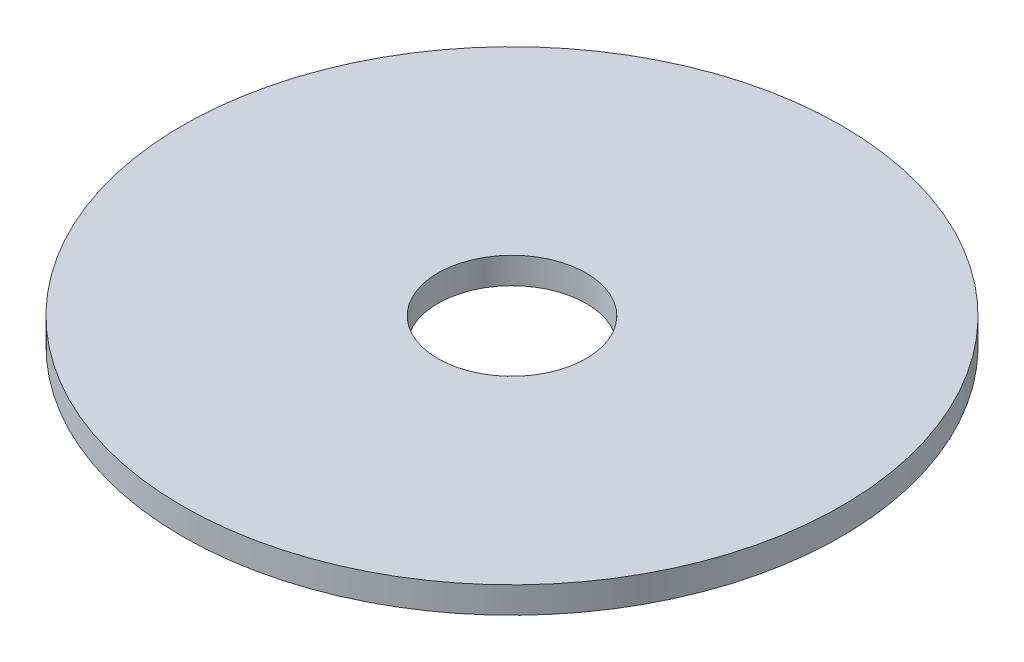
from build123d import *

# Parameters (mm, degrees)
SKETCH1_R           = 100
BOSS_EXTRUDE1_DEPTH = 8
SKETCH2_R           = 22.5
CUT_EXTRUDE1_DEPTH  = 142.647449677


with BuildPart() as part:
    # Sketch1 → Boss-Extrude1 (new body)
    with BuildSketch(Plane(origin=(0, 0, 0), x_dir=(1, 0, 0), z_dir=(0, 1, 0))):
        Circle(SKETCH1_R)
    extrude(amount=BOSS_EXTRUDE1_DEPTH)

    # Sketch2 → Cut-Extrude1 (cut, through all)
    with BuildSketch(Plane(origin=(0, 0, 0), x_dir=(1, 0, 0), z_dir=(0, 1, 0))):
        Circle(SKETCH2_R)
    extrude(amount=CUT_EXTRUDE1_DEPTH, mode=Mode.SUBTRACT)


solid = part.part
